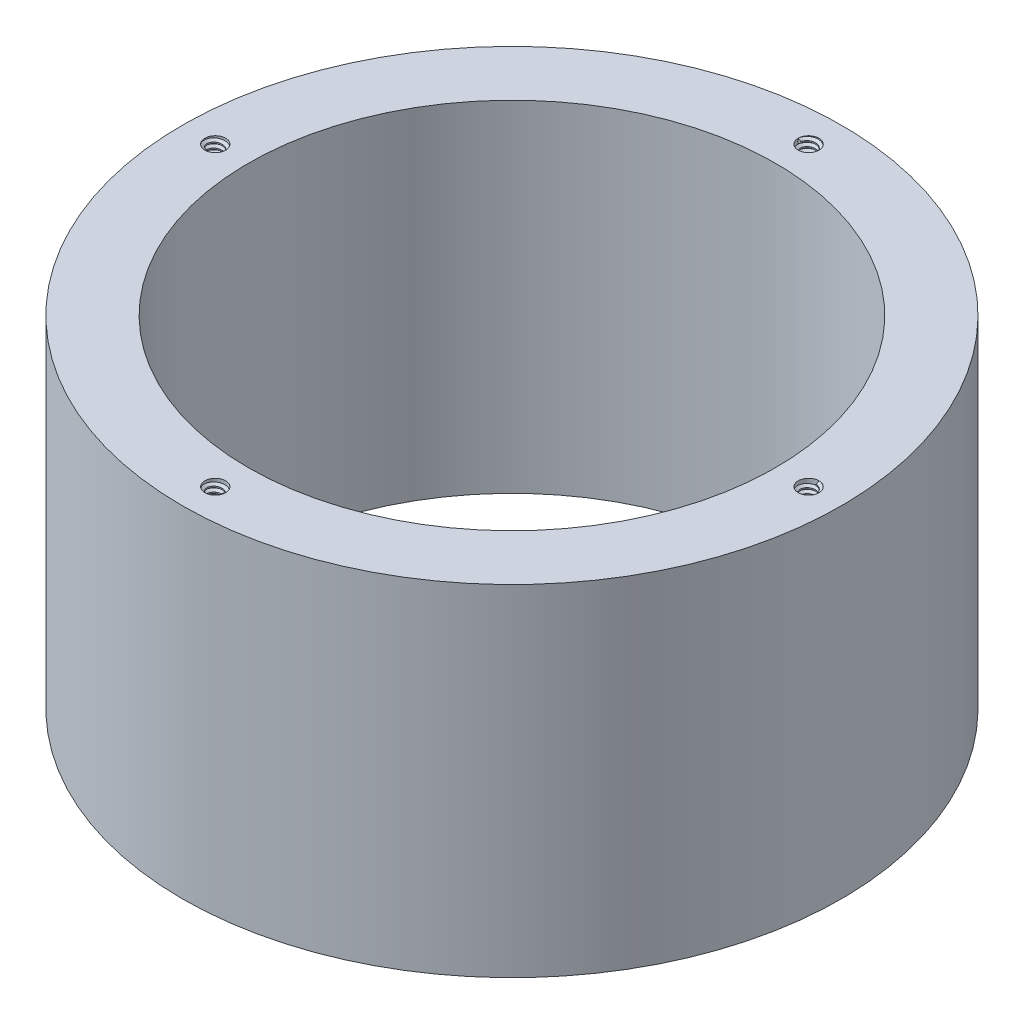
from build123d import *
from build123d.topology import SkipClean

# Parameters (mm, degrees)
SKETCH1_R           = 15.875
SKETCH1_R_2         = 12.7
BOSS_EXTRUDE1_DEPTH = 16.4
SKETCH2_R           = 0.5
CUT_EXTRUDE1_DEPTH  = 2
THREAD1_PITCH       = 0.25
CIRPATTERN1_COUNT   = 4
CUT_EXTRUDE2_START  = -2
SKETCH7_R           = 0.5
CUT_EXTRUDE2_DEPTH  = 2
THREAD2_PITCH       = 0.25
CIRPATTERN2_COUNT   = 4


with BuildPart() as part:
    # Sketch1 → Boss-Extrude1 (new body)
    with BuildSketch(Plane(origin=(0, 0, 0), x_dir=(1, 0, 0), z_dir=(0, 1, 0))):
        with Locations(Location((0, 0, 0), (0, 0, 270))):
            Circle(SKETCH1_R)
        with Locations(Location((0, 0, 0), (0, 0, 270))):
            Circle(SKETCH1_R_2, mode=Mode.SUBTRACT)
    extrude(amount=BOSS_EXTRUDE1_DEPTH)

    # Sketch2 → Cut-Extrude1 (cut)
    with BuildSketch(Plane(origin=(0, 16.4, 0), x_dir=(1, 0, 0), z_dir=(0, 1, 0))):
        with Locations(Location((0, 14.29, 0), (0, 0, 270))):
            Circle(SKETCH2_R)
    cut_extrude1 = extrude(amount=-CUT_EXTRUDE1_DEPTH, mode=Mode.SUBTRACT)

    # Thread1: the profile of Thread Profile2 profile screwed along a right-hand helix of 8 turns, 6 arcs to a turn; built about Z, then put on its axis
    with SkipClean():  # the faces are left unmerged after this step: merging them gives an invalid solid
        thread1_z = Axis((0, 0, 0), (0, 0, 1))
        thread1_corners = [(0.5003, 0, -0.000173205), (0.5003, 0, 0.218923204), (0.364683531, 0, 0.140625), (0.364683531, 0, 0.078125)]
        with BuildLine(mode=Mode.PRIVATE) as thread1_profile:
            Line(thread1_corners[0], thread1_corners[1])
            Line(thread1_corners[1], thread1_corners[2])
            Line(thread1_corners[2], thread1_corners[3])
            Line(thread1_corners[3], thread1_corners[0])
        thread1_cap = Face(thread1_profile.wire())
        thread1_turn_angles = [0, 30, 60, 90, 120, 150, 180, 210, 240, 270, 300, 330, 360]
        thread1_turn_weights = [1, 0.8660254037844387, 1, 0.8660254037844387, 1, 0.8660254037844387, 1, 0.8660254037844387, 1, 0.8660254037844387, 1, 0.8660254037844387, 1]
        thread1_turn_rails = [Edge.make_bspline([Vector(p[0], p[1], 0).rotate(thread1_z, thread1_turn_angles[k]) / thread1_turn_weights[k] + Vector(0, 0, p[2] + THREAD1_PITCH * thread1_turn_angles[k] / 360) for k in range(13)], [0, 0, 0, 1, 1, 2, 2, 3, 3, 4, 4, 5, 5, 6, 6, 6], 2, thread1_turn_weights) for p in thread1_corners]
        thread1_turn_sides = [Face.make_surface_from_curves(thread1_turn_rails[p[0]], thread1_turn_rails[p[1]]) for p in [(0, 1), (1, 2), (2, 3), (3, 0)]]
        thread1 = Plane(origin=(0, 16.4, -14.29), x_dir=(-1, 0, 0), z_dir=(0, -1, 0)) * Solid(Shell([*[p.moved(Location((0, 0, THREAD1_PITCH * i))) for i in range(8) for p in thread1_turn_sides], thread1_cap, thread1_cap.rotate(thread1_z, 2880).moved(Location((0, 0, THREAD1_PITCH * 2880 / 360)))]))
        add(thread1)

    # CirPattern1: Cut-Extrude1, Thread1 ×4 about axis
    with SkipClean():  # the faces are left unmerged after this step: merging them gives an invalid solid
        cirpattern1_axis = Axis((0, 16.4, 0), (0, 1, 0))
        add([cut_extrude1.rotate(cirpattern1_axis, i * 360 / CIRPATTERN1_COUNT) for i in range(1, CIRPATTERN1_COUNT)], mode=Mode.SUBTRACT)
        add([thread1.rotate(cirpattern1_axis, i * 360 / CIRPATTERN1_COUNT) for i in range(1, CIRPATTERN1_COUNT)])

    # Sketch7 → Cut-Extrude2 (cut)
    with SkipClean():  # the faces are left unmerged after this step: merging them gives an invalid solid
        with BuildSketch(Plane.XZ.offset(CUT_EXTRUDE2_START)):
            with Locations(Location((0, 14.29, 0), (0, 0, 270))):
                Circle(SKETCH7_R)
        cut_extrude2 = extrude(amount=CUT_EXTRUDE2_DEPTH, mode=Mode.SUBTRACT)

    # Thread2: the profile of Thread Profile3 profile screwed along a right-hand helix of 8 turns, 6 arcs to a turn; built about Z, then put on its axis
    with SkipClean():  # the faces are left unmerged after this step: merging them gives an invalid solid
        thread2_z = Axis((0, 0, 0), (0, 0, 1))
        thread2_corners = [(0.5003, 0, -0.000173205), (0.5003, 0, 0.218923204), (0.364683531, 0, 0.140625), (0.364683531, 0, 0.078125)]
        with BuildLine(mode=Mode.PRIVATE) as thread2_profile:
            Line(thread2_corners[0], thread2_corners[1])
            Line(thread2_corners[1], thread2_corners[2])
            Line(thread2_corners[2], thread2_corners[3])
            Line(thread2_corners[3], thread2_corners[0])
        thread2_cap = Face(thread2_profile.wire())
        thread2_turn_angles = [0, 30, 60, 90, 120, 150, 180, 210, 240, 270, 300, 330, 360]
        thread2_turn_weights = [1, 0.8660254037844387, 1, 0.8660254037844387, 1, 0.8660254037844387, 1, 0.8660254037844387, 1, 0.8660254037844387, 1, 0.8660254037844387, 1]
        thread2_turn_rails = [Edge.make_bspline([Vector(p[0], p[1], 0).rotate(thread2_z, thread2_turn_angles[k]) / thread2_turn_weights[k] + Vector(0, 0, p[2] + THREAD2_PITCH * thread2_turn_angles[k] / 360) for k in range(13)], [0, 0, 0, 1, 1, 2, 2, 3, 3, 4, 4, 5, 5, 6, 6, 6], 2, thread2_turn_weights) for p in thread2_corners]
        thread2_turn_sides = [Face.make_surface_from_curves(thread2_turn_rails[p[0]], thread2_turn_rails[p[1]]) for p in [(0, 1), (1, 2), (2, 3), (3, 0)]]
        thread2 = Plane(origin=(0, 0, 14.29), x_dir=(1, 0, 0), z_dir=(0, 1, 0)) * Solid(Shell([*[p.moved(Location((0, 0, THREAD2_PITCH * i))) for i in range(8) for p in thread2_turn_sides], thread2_cap, thread2_cap.rotate(thread2_z, 2880).moved(Location((0, 0, THREAD2_PITCH * 2880 / 360)))]))
        add(thread2)

    # CirPattern2: Cut-Extrude2, Thread2 ×4 about axis
    with SkipClean():  # the faces are left unmerged after this step: merging them gives an invalid solid
        cirpattern2_axis = Axis((0, 0, 0), (0, 1, 0))
        add([cut_extrude2.rotate(cirpattern2_axis, i * 360 / CIRPATTERN2_COUNT) for i in range(1, CIRPATTERN2_COUNT)], mode=Mode.SUBTRACT)
        add([thread2.rotate(cirpattern2_axis, i * 360 / CIRPATTERN2_COUNT) for i in range(1, CIRPATTERN2_COUNT)])


solid = part.part
